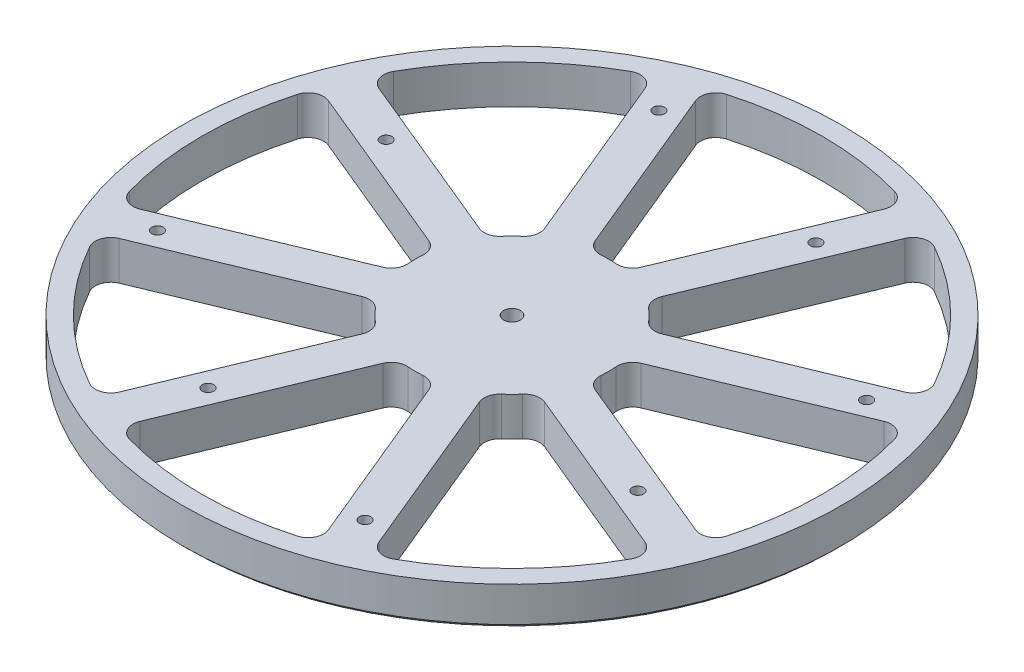
from build123d import *

# Parameters (mm, degrees)
SKETCH2_W                    = 84.99983
SKETCH2_H                    = 10
F_32_0_116_DIAMETER_HOLE1_D  = 2.9464
CIRPATTERN3_COUNT            = 4
CUT_EXTRUDE1_DEPTH           = 121.623141229
FILLET1_R                    = 4
CIRPATTERN4_COUNT            = 8
FILLET1_OF_CIRPATTERN4_R     = 4
CHAMFER2_SIZE                = 1
F_18_0_1695_DIAMETER_HOLE1_D = 4.3053


with BuildPart() as part:
    # Sketch2 → Revolve1 (revolve)
    with BuildSketch(Plane(origin=(0, 0, 0), x_dir=(0, 0, -1), z_dir=(1, 0, 0))):
        with Locations((-42.499915, 5)):
            Rectangle(SKETCH2_W, SKETCH2_H)
    revolve(axis=Axis((0, -0.75, 0), (0, 1, 0)))

    # #32 (0.116) Diameter Hole1 (through all)
    with Locations(Plane(origin=(0, 10, 0), x_dir=(1, 0, 0), z_dir=(0, 1, 0))):
        with Locations((-26.787840266, 64.671567276), (-55.432771951, 22.961005942)):
            f_32_0_116_diameter_hole1 = Hole(F_32_0_116_DIAMETER_HOLE1_D / 2)

    # CirPattern3: #32 (0.116) Diameter Hole1 ×4 about axis
    cirpattern3_axis = Axis((0, -0.75, 0), (0, 1, 0))
    for i in range(1, CIRPATTERN3_COUNT):
        add(f_32_0_116_diameter_hole1.rotate(cirpattern3_axis, i * 360 / CIRPATTERN3_COUNT), mode=Mode.SUBTRACT)

    # Sketch8 → Cut-Extrude1 (cut, through all)
    with BuildSketch(Plane(origin=(0, 10, 0), x_dir=(1, 0, 0), z_dir=(0, 1, 0))):
        with BuildLine():
            Line((-4.754393761, 24.543751546), (-25.93535895, 75.67912497))
            ThreePointArc((-25.93535895, 75.67912497), (0, 79.99983), (25.93535895, 75.67912497))
            Line((25.93535895, 75.67912497), (4.754393761, 24.543751546))
            ThreePointArc((4.754393761, 24.543751546), (0, 25), (-4.754393761, 24.543751546))
        make_face()
    cut_extrude1 = extrude(amount=-CUT_EXTRUDE1_DEPTH, mode=Mode.SUBTRACT)

    # Fillet1
    fillet1_edges = [part.edges().sort_by_distance(p)[0] for p in [
        (4.754393761, 5, -24.543751546),
        (25.93535895, 5, -75.67912497),
        (-4.754393761, 5, -24.543751546),
        (-25.93535895, 5, -75.67912497),
    ]]
    fillet(fillet1_edges, radius=FILLET1_R)

    # CirPattern4: Cut-Extrude1 ×8 about axis
    cirpattern4_axis = Axis((0, -0.75, 0), (0, 1, 0))
    for i in range(1, CIRPATTERN4_COUNT):
        add(cut_extrude1.rotate(cirpattern4_axis, i * 360 / CIRPATTERN4_COUNT), mode=Mode.SUBTRACT)

    # Fillet1 of CirPattern4
    fillet1_of_cirpattern4_edges = [part.edges().sort_by_distance(p)[0] for p in [
        (-13.993189086, 5, -20.716917223),
        (-35.174154275, 5, -71.852290646),
        (-20.716917223, 5, -13.993189086),
        (-71.852290646, 5, -35.174154275),
        (-24.543751546, 5, -4.754393761),
        (-75.67912497, 5, -25.93535895),
        (-24.543751546, 5, 4.754393761),
        (-75.67912497, 5, 25.93535895),
        (-20.716917223, 5, 13.993189086),
        (-71.852290646, 5, 35.174154275),
        (-13.993189086, 5, 20.716917223),
        (-35.174154275, 5, 71.852290646),
        (-4.754393761, 5, 24.543751546),
        (-25.93535895, 5, 75.67912497),
        (4.754393761, 5, 24.543751546),
        (25.93535895, 5, 75.67912497),
        (13.993189086, 5, 20.716917223),
        (35.174154275, 5, 71.852290646),
        (20.716917223, 5, 13.993189086),
        (71.852290646, 5, 35.174154275),
        (24.543751546, 5, 4.754393761),
        (75.67912497, 5, 25.93535895),
        (24.543751546, 5, -4.754393761),
        (75.67912497, 5, -25.93535895),
        (20.716917223, 5, -13.993189086),
        (71.852290646, 5, -35.174154275),
        (13.993189086, 5, -20.716917223),
        (35.174154275, 5, -71.852290646),
    ]]
    fillet(fillet1_of_cirpattern4_edges, radius=FILLET1_OF_CIRPATTERN4_R)

    # Chamfer2
    chamfer2_edges = [part.edges().sort_by_distance(p)[0] for p in [
        (0, 0, -84.99983),
    ]]
    chamfer(chamfer2_edges, length=CHAMFER2_SIZE)

    # #18 (0.1695) Diameter Hole1 (through all)
    with Locations(Plane(origin=(0, 0, 0), x_dir=(-1, 0, 0), z_dir=(0, -1, 0))):
        with Locations((0, 0)):
            Hole(F_18_0_1695_DIAMETER_HOLE1_D / 2)


solid = part.part
